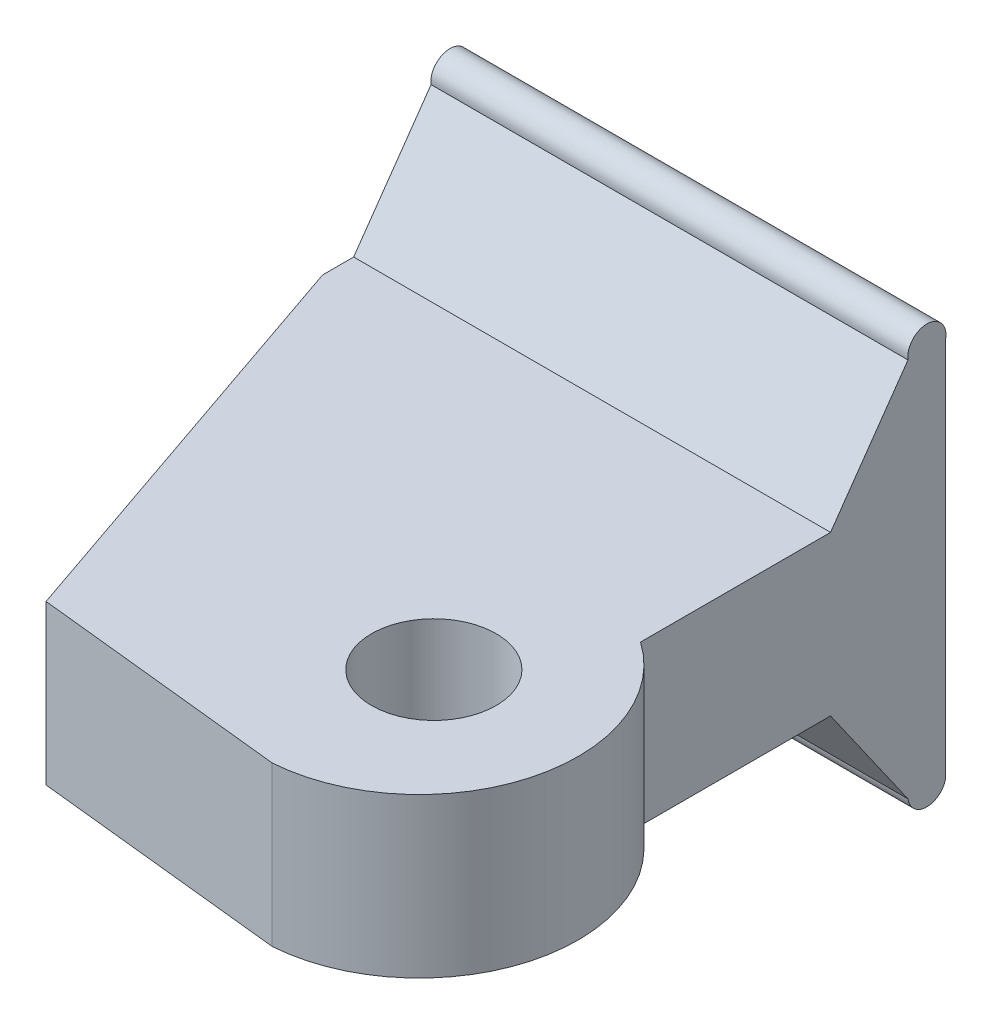
from build123d import *

# Parameters (mm, degrees)
SKETCH1_R               = 2.4892
BOSS_EXTRUDE1_DEPTH     = 6.35
BOSS_EXTRUDE2_START     = -6.35
BOSS_EXTRUDE2_DEPTH     = 19.05
BOSS_EXTRUDE2_START_2   = -6.555460136
BOSS_EXTRUDE2_2_DEPTH   = 19.460920272
BOSS_EXTRUDE2_START_3   = -10
BOSS_EXTRUDE2_3_DEPTH   = 3.65
CUT_EXTRUDE1_DEPTH      = 27.910448217
CUT_EXTRUDE1_DEPTH_BACK = 27.910448217
SKETCH3_W               = 2.179354936
SKETCH3_H               = 6.35
CUT_EXTRUDE2_DEPTH      = 31.98795935
CUT_EXTRUDE2_DEPTH_BACK = 31.98795935


with BuildPart() as part:
    # Sketch1 → Boss-Extrude1 (new body)
    with BuildSketch(Plane(origin=(0, 0, 0), x_dir=(1, 0, 0), z_dir=(0, 1, 0))):
        with BuildLine():
            Line((9.525, -17.889269346), (-0.578271622, -16.817120786))
            Line((-0.578271622, -16.817120786), (-6.35, 0))
            Line((-6.35, 0), (12.7, 0))
            Line((12.7, 0), (12.7, -6.35))
            ThreePointArc((12.7, -6.35), (15.186560179, -13.240601753), (9.525, -17.889269346))
        make_face()
        with Locations(Location((9.525, -11.43, 0), (0, 0, 270))):
            Circle(SKETCH1_R, mode=Mode.SUBTRACT)
    extrude(amount=BOSS_EXTRUDE1_DEPTH)

    # Boss-Extrude2: read off the stored shape, not the designer's step
    # Boss-Extrude2 outline → Boss-Extrude2 (add)
    with BuildSketch(Plane.YZ.offset(BOSS_EXTRUDE2_START)):
        with BuildLine():
            ThreePointArc((11.551615481, -6.35), (12.905510296, -4.996105185), (11.551615481, -3.642210371))
            Line((11.551615481, -3.642210371), (6.35, 0))
            Line((6.35, 0), (0, 0))
            Line((0, 0), (-5.201615481, -3.642210371))
            ThreePointArc((-5.201615481, -3.642210371), (-6.555510296, -4.996105185), (-5.201615481, -6.35))
            Line((-5.201615481, -6.35), (11.551615481, -6.35))
        make_face()
    extrude(amount=BOSS_EXTRUDE2_DEPTH)

    # Boss-Extrude2 2 outline → Boss-Extrude2 2 (add)
    with BuildSketch(Plane(origin=(0, 0, 0), x_dir=(1, 0, 0), z_dir=(0, 1, 0)).offset(BOSS_EXTRUDE2_START_2)):
        Polygon((-8.529354936, 6.35), (-6.35, 0), (-6.35, 6.35), align=None)
    extrude(amount=BOSS_EXTRUDE2_2_DEPTH)

    # Boss-Extrude2 3 outline → Boss-Extrude2 3 (cut)
    with BuildSketch(Plane.YZ.offset(BOSS_EXTRUDE2_START_3)):
        with BuildLine():
            Line((12.905460136, 0), (6.35, 0))
            Line((6.35, 0), (11.551615481, -3.642210371))
            ThreePointArc((11.551615481, -3.642210371), (12.504834401, -4.034645431), (12.905460136, -4.984450993))
            Line((12.905460136, -4.984450993), (12.905460136, 0))
        make_face()
        with BuildLine():
            ThreePointArc((12.905460136, -5.007759378), (12.504834401, -5.95756494), (11.551615481, -6.35))
            Line((11.551615481, -6.35), (12.905460136, -6.35))
            Line((12.905460136, -6.35), (12.905460136, -5.007759378))
        make_face()
        with BuildLine():
            Line((0, 0), (-6.555460136, 0))
            Line((-6.555460136, 0), (-6.555460136, -4.984450993))
            ThreePointArc((-6.555460136, -4.984450993), (-6.154834401, -4.034645431), (-5.201615481, -3.642210371))
            Line((-5.201615481, -3.642210371), (0, 0))
        make_face()
        with BuildLine():
            ThreePointArc((-5.201615481, -6.35), (-6.154834401, -5.95756494), (-6.555460136, -5.007759378))
            Line((-6.555460136, -5.007759378), (-6.555460136, -6.35))
            Line((-6.555460136, -6.35), (-5.201615481, -6.35))
        make_face()
    extrude(amount=BOSS_EXTRUDE2_3_DEPTH, mode=Mode.SUBTRACT)

    # Sketch3 → Cut-Extrude1 (cut, two sides: drawn at the far end of the back side and taken through both)
    with BuildSketch(Plane.XZ.offset(-CUT_EXTRUDE1_DEPTH_BACK)):
        with Locations((-7.439677468, -3.175)):
            Rectangle(SKETCH3_W, SKETCH3_H)
    extrude(amount=CUT_EXTRUDE1_DEPTH + CUT_EXTRUDE1_DEPTH_BACK, mode=Mode.SUBTRACT)

    # Sketch4 → Cut-Extrude2 (cut, two sides: drawn at the far end of the back side and taken through both)
    with BuildSketch(Plane.ZY.offset(6.35).offset(-CUT_EXTRUDE2_DEPTH_BACK)):
        with BuildLine():
            ThreePointArc((-5.842, -4.417095512), (-5.087595278, -5.071775822), (-4.333190556, -4.417095512))
            Line((-4.333190556, -4.417095512), (-1.240306982, 0))
            Line((-1.240306982, 0), (0, 0))
            Line((0, 0), (-3.642210371, -5.201615481))
            ThreePointArc((-3.642210371, -5.201615481), (-4.996105185, -6.555510296), (-6.35, -5.201615481))
            Line((-6.35, -5.201615481), (-6.35, 11.551615481))
            ThreePointArc((-6.35, 11.551615481), (-4.996105185, 12.905510296), (-3.642210371, 11.551615481))
            Line((-3.642210371, 11.551615481), (0, 6.35))
            Line((0, 6.35), (-1.240306982, 6.35))
            Line((-1.240306982, 6.35), (-4.333190556, 10.767095512))
            ThreePointArc((-4.333190556, 10.767095512), (-5.087595278, 11.636415201), (-5.842, 10.767095512))
            Line((-5.842, 10.767095512), (-5.842, -4.417095512))
        make_face()
    extrude(amount=CUT_EXTRUDE2_DEPTH + CUT_EXTRUDE2_DEPTH_BACK, mode=Mode.SUBTRACT)


solid = part.part
